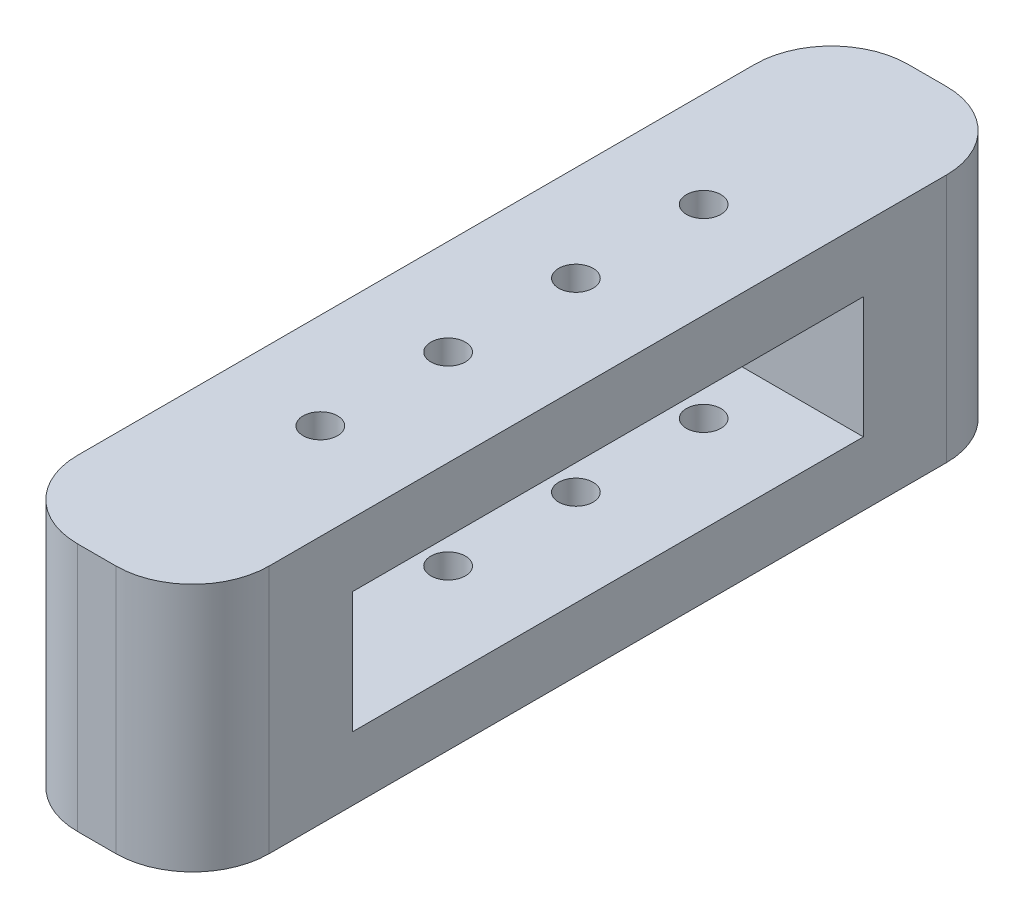
from build123d import *

# Parameters (mm, degrees)
SKETCH1_W           = 15
SKETCH1_H           = 65
SKETCH1_R           = 1.35
BOSS_EXTRUDE1_DEPTH = 19.5
FILLET1_R           = 6
SKETCH2_W           = 40
SKETCH2_H           = 9.5
CUT_EXTRUDE1_DEPTH  = 20


with BuildPart() as part:
    # Sketch1 → Boss-Extrude1 (new body)
    with BuildSketch(Plane(origin=(0, 0, 0), x_dir=(1, 0, 0), z_dir=(0, 1, 0))):
        with Locations((0, -32.5)):
            Rectangle(SKETCH1_W, SKETCH1_H)
        with Locations((0, -17.5)):
            Circle(SKETCH1_R, mode=Mode.SUBTRACT)
        with Locations((0, -27.5)):
            Circle(SKETCH1_R, mode=Mode.SUBTRACT)
        with Locations((0, -37.5)):
            Circle(SKETCH1_R, mode=Mode.SUBTRACT)
        with Locations((0, -47.5)):
            Circle(SKETCH1_R, mode=Mode.SUBTRACT)
    extrude(amount=BOSS_EXTRUDE1_DEPTH)

    # Fillet1
    fillet1_edges = [part.edges().sort_by_distance(p)[0] for p in [
        (-7.5, 9.75, 65),
        (7.5, 9.75, 65),
        (-7.5, 9.75, 0),
        (7.5, 9.75, 0),
    ]]
    fillet(fillet1_edges, radius=FILLET1_R)

    # Sketch2 → Cut-Extrude1 (cut)
    with BuildSketch(Plane.ZY.offset(7.5)):
        with Locations((32.5, 9.75)):
            Rectangle(SKETCH2_W, SKETCH2_H)
    extrude(amount=-CUT_EXTRUDE1_DEPTH, mode=Mode.SUBTRACT)


solid = part.part
